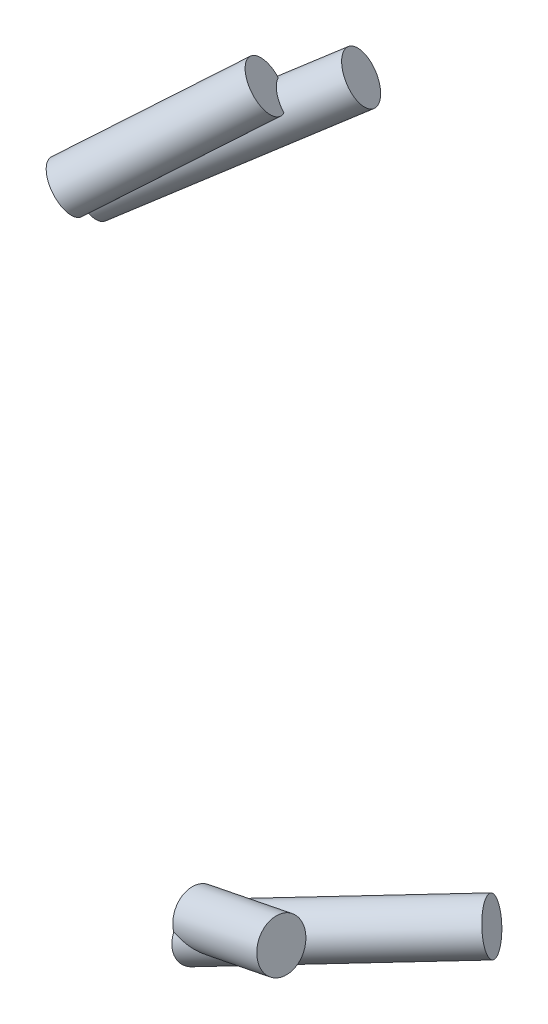
from build123d import *

# Parameters (mm, degrees)
SUSP_RR_ROCKER_BRACKET_A_PROFILE_R   = 7
SUSP_RR_ROCKER_BRACKET_B_START       = 582.103316114
SUSP_RR_ROCKER_BRACKET_B_OUTLINE_R   = 7
SUSP_RR_ROCKER_BRACKET_B_DEPTH       = 59.237735171
SUSP_RR_ROCKER_BRACKET_B_START_2     = 573.503727818
SUSP_RR_ROCKER_BRACKET_B_2_OUTLINE_R = 7
SUSP_RR_ROCKER_BRACKET_B_2_DEPTH     = 8.599588296
SUSP_RR_ROCKER_BRACKET_B_START_3     = 488
SUSP_RR_ROCKER_BRACKET_B_3_OUTLINE_W = 17
SUSP_RR_ROCKER_BRACKET_B_3_OUTLINE_H = 18
SUSP_RR_ROCKER_BRACKET_B_3_DEPTH     = 8.001614425
SUSP_RR_COILOVER_BRACKET_A_PROFILE_R = 7
SUSP_RR_COILOVER_BRACKET_B_PROFILE_R = 7


with BuildPart() as part:
    # SUSP_RR_rocker_bracket_a: sweep along a curve in space
    with BuildLine() as susp_rr_rocker_bracket_a_path:
        Line((263.769266, 1173.5341, -262.913084), (288.828884, 1178.80091, -262.576559))
    # SUSP_RR_rocker_bracket_a profile (on start of the path) → SUSP_RR_rocker_bracket_a (sweep)
    with BuildSketch(Plane(origin=(263.769266, 1173.5341, -262.913084), x_dir=(-0.20567769530184105, 0.9786197860534618, 0), z_dir=(0.9785352890118953, 0.2056599364571734, 0.013140726571920548))):
        Circle(SUSP_RR_ROCKER_BRACKET_A_PROFILE_R)
    sweep(path=susp_rr_rocker_bracket_a_path.line)

    # SUSP_RR_rocker_bracket_b: read off the stored shape, not the designer's step
    # SUSP_RR_rocker_bracket_b outline → SUSP_RR_rocker_bracket_b (add)
    with BuildSketch(Plane(origin=(0, 0, 0), x_dir=(0.5458835432361197, -0.29060444522986084, 0.7858499943606441), z_dir=(0.837861060811385, 0.189334713906647, -0.51199727429539)).offset(SUSP_RR_ROCKER_BRACKET_B_START)):
        with Locations((-402.143607902, -1005.781118034)):
            Circle(SUSP_RR_ROCKER_BRACKET_B_OUTLINE_R)
    extrude(amount=SUSP_RR_ROCKER_BRACKET_B_DEPTH)

    # SUSP_RR_rocker_bracket_b 2 outline → SUSP_RR_rocker_bracket_b 2 (add)
    with BuildSketch(Plane(origin=(0, 0, 0), x_dir=(0.5458835432361197, -0.29060444522986084, 0.7858499943606441), z_dir=(0.837861060811385, 0.189334713906647, -0.51199727429539)).offset(SUSP_RR_ROCKER_BRACKET_B_START_2)):
        with Locations((-402.143607902, -1005.781118034)):
            Circle(SUSP_RR_ROCKER_BRACKET_B_2_OUTLINE_R)
    extrude(amount=SUSP_RR_ROCKER_BRACKET_B_2_DEPTH)

    # SUSP_RR_rocker_bracket_b 3 outline → SUSP_RR_rocker_bracket_b 3 (cut)
    with BuildSketch(Plane(origin=(0, 0, 0), x_dir=(-0.20564139487715902, 0.9786235182829146, -0.0027615532850912184), z_dir=(0.9785352890118946, 0.2056599364571769, 0.013140726571917593)).offset(SUSP_RR_ROCKER_BRACKET_B_START_3)):
        with Locations((1090.5, -266)):
            Rectangle(SUSP_RR_ROCKER_BRACKET_B_3_OUTLINE_W, SUSP_RR_ROCKER_BRACKET_B_3_OUTLINE_H)
    extrude(amount=SUSP_RR_ROCKER_BRACKET_B_3_DEPTH, mode=Mode.SUBTRACT)


with BuildPart() as body_2:
    # SUSP_RR_coilover_bracket_a: sweep along a curve in space
    with BuildLine() as susp_rr_coilover_bracket_a_path:
        Line((206.541275, 1321.55687, -281.622316), (240.881884, 1352.27636, -305.851027))
    # SUSP_RR_coilover_bracket_a profile (on start of the path) → SUSP_RR_coilover_bracket_a (sweep)
    with BuildSketch(Plane(origin=(206.541275, 1321.55687, -281.622316), x_dir=(-0.6667186997086567, 0.7453094494629717, 0), z_dir=(0.6596654729611602, 0.5901056355749471, -0.46542110249280333))):
        Circle(SUSP_RR_COILOVER_BRACKET_A_PROFILE_R)
    sweep(path=susp_rr_coilover_bracket_a_path.line)

    # SUSP_RR_coilover_bracket_b: sweep along a curve in space
    with BuildLine() as susp_rr_coilover_bracket_b_path:
        Line((205.492137, 1315.8651, -290.325886), (254.064716, 1353.56644, -320.835973))
    # SUSP_RR_coilover_bracket_b profile (on start of the path) → SUSP_RR_coilover_bracket_b (sweep)
    with BuildSketch(Plane(origin=(205.492137, 1315.8651, -290.325886), x_dir=(-0.6131566671765795, 0.7899613291148557, 0), z_dir=(0.7076347872393257, 0.5492559847303456, -0.44448944996102296))):
        Circle(SUSP_RR_COILOVER_BRACKET_B_PROFILE_R)
    sweep(path=susp_rr_coilover_bracket_b_path.line)


solid = Compound([part.part, body_2.part])
